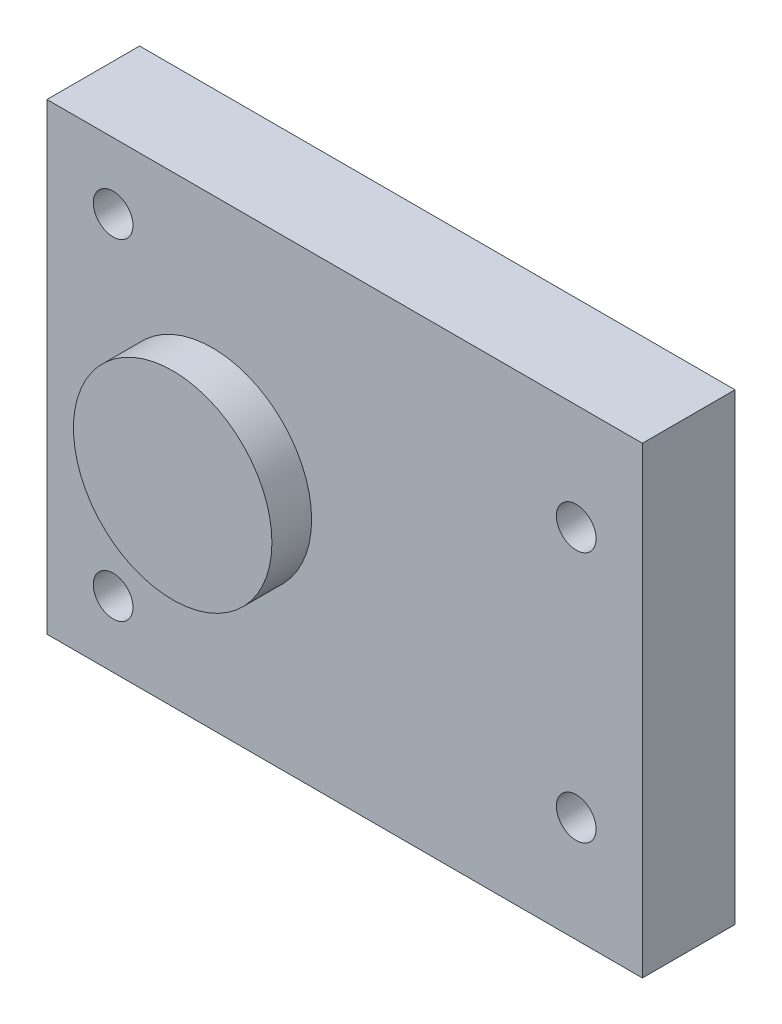
from build123d import *

# Parameters (mm, degrees)
SKETCH1_R               = 1.5
BOSS_EXTRUDE1_DEPTH     = 7
SKETCH5_R               = 7.5
BOSS_EXTRUDE5_DEPTH     = 3
CUT_EXTRUDE1_DEPTH      = 3
CUT_EXTRUDE1_DEPTH_BACK = 3
SKETCH1_3_R             = 4


with BuildPart() as part:
    # Sketch1 → Boss-Extrude1 (new body)
    with BuildSketch(Plane.XY):
        Polygon((-47.5, 17.5), (-92.5, 17.5), (-92.5, 0), (-92.5, -17.5), (-47.5, -17.5), align=None)
        with Locations((-87.5, -12.5)):
            Circle(SKETCH1_R, mode=Mode.SUBTRACT)
        with Locations((-52.5, -9.5)):
            Circle(SKETCH1_R, mode=Mode.SUBTRACT)
        with Locations((-87.5, 12.5)):
            Circle(SKETCH1_R, mode=Mode.SUBTRACT)
        with Locations((-52.5, 9.5)):
            Circle(SKETCH1_R, mode=Mode.SUBTRACT)
    extrude(amount=BOSS_EXTRUDE1_DEPTH)

    # Sketch5 → Boss-Extrude5 (add)
    with BuildSketch(Plane.XY.offset(7)):
        with Locations((-80, 0)):
            Circle(SKETCH5_R)
    extrude(amount=BOSS_EXTRUDE5_DEPTH)

    # Sketch1<3> → Cut-Extrude1 (cut, two sides: drawn at the far end of the back side and taken through both)
    with BuildSketch(Plane.XY.offset(-CUT_EXTRUDE1_DEPTH_BACK)):
        with Locations((-80, 0)):
            Circle(SKETCH1_3_R)
    extrude(amount=CUT_EXTRUDE1_DEPTH + CUT_EXTRUDE1_DEPTH_BACK, mode=Mode.SUBTRACT)


solid = part.part
